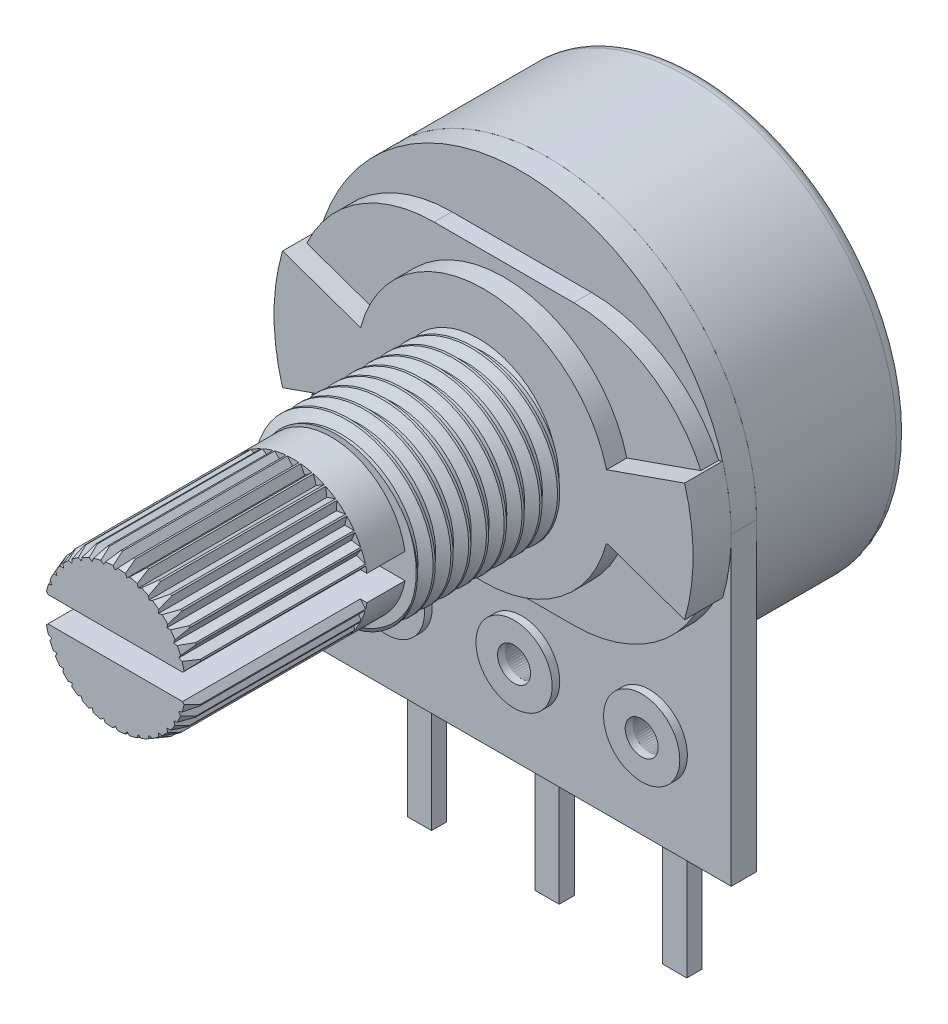
from build123d import *
from OCP.BRepFilletAPI import BRepFilletAPI_MakeChamfer

# Parameters (mm, degrees)
SKETCH1_R                   = 8.25
BOSS_EXTRUDE1_DEPTH         = 6
BOSS_EXTRUDE2_DEPTH         = 1
SKETCH3_R                   = 0.65
BOSS_EXTRUDE3_DEPTH         = 0.6
BOSS_EXTRUDE3_2_DEPTH       = 0.6
BOSS_EXTRUDE3_3_DEPTH       = 0.6
BOSS_EXTRUDE4_DEPTH         = 1.5
BOSS_EXTRUDE8_DEPTH         = 0.7
SKETCH5_R                   = 3.35
BOSS_EXTRUDE5_DEPTH         = 6
BOSS_EXTRUDE6_DEPTH         = 8.5
THREAD1_PITCH               = 0.7
CHAMFER1_SIZE               = 0.5
CHAMFER1_SIZE2              = 0.181985117
CUT_EXTRUDE2_DEPTH          = 7
SKETCH16_W                  = 3.655172414
SKETCH16_H                  = 2
CUT_EXTRUDE5_DEPTH          = 2.75
FILLET1_R                   = 0.5
SHELL2_START                = 0.5
SHELL2_DEPTH                = 5.5
SHELL2_START_2              = 3.25
SHELL2_2_DEPTH              = 2.75
CUT_EXTRUDE3_DEPTH          = 2
SKETCH13_R                  = 0.65
CUT_EXTRUDE4_DEPTH          = 2
BOSS_EXTRUDE7_START         = -1
BOSS_EXTRUDE7_OUTLINE_R     = 1.5
BOSS_EXTRUDE7_OUTLINE_R_2   = 0.65
BOSS_EXTRUDE7_DEPTH         = 1.3
BOSS_EXTRUDE7_2_OUTLINE_R   = 1.5
BOSS_EXTRUDE7_2_OUTLINE_R_2 = 0.65
BOSS_EXTRUDE7_2_DEPTH       = 1.3
BOSS_EXTRUDE7_3_OUTLINE_R   = 1.5
BOSS_EXTRUDE7_3_OUTLINE_R_2 = 0.65
BOSS_EXTRUDE7_3_DEPTH       = 1.3


# Read off the part's stored shape, not the designer's step: Shell2, Boss-Extrude7
with BuildPart() as part:
    # Sketch1 → Boss-Extrude1 (new body)
    with BuildSketch(Plane.XY):
        Circle(SKETCH1_R)
    extrude(amount=BOSS_EXTRUDE1_DEPTH)

    # Sketch16 → Cut-Extrude5 (cut)
    with BuildSketch(Plane(origin=(0, 0, 0), x_dir=(-1, 0, 0), z_dir=(0, 0, -1))):
        with Locations((8.327586207, 0)):
            Rectangle(SKETCH16_W, SKETCH16_H)
    extrude(amount=-CUT_EXTRUDE5_DEPTH, mode=Mode.SUBTRACT)

    # Fillet1
    fillet1_edges = [part.edges().sort_by_distance(p)[0] for p in [
        (0.500924228, 8.234778377, 0),
        (-8.25, 0, 2.75),
        (-6.5, 0, 0),
    ]]
    fillet(fillet1_edges, radius=FILLET1_R)

    # Shell2 outline → Shell2 (cut)
    with BuildSketch(Plane.XY.offset(SHELL2_START)):
        with BuildLine():
            ThreePointArc((-7.685213074, -1), (7.75, 0), (-7.685213074, 1))
            Line((-7.685213074, 1), (-6, 1))
            Line((-6, 1), (-6, -1))
            Line((-6, -1), (-7.685213074, -1))
        make_face()
    extrude(amount=SHELL2_DEPTH, mode=Mode.SUBTRACT)

    # Shell2 2 outline → Shell2 2 (cut)
    with BuildSketch(Plane.XY.offset(SHELL2_START_2)):
        with BuildLine():
            Line((-6, 1), (-7.685213074, 1))
            ThreePointArc((-7.685213074, 1), (-7.75, 0), (-7.685213074, -1))
            Line((-7.685213074, -1), (-6, -1))
            Line((-6, -1), (-6, 1))
        make_face()
    extrude(amount=SHELL2_2_DEPTH, mode=Mode.SUBTRACT)

    # Sketch12 → Cut-Extrude3 (cut)
    with BuildSketch(Plane(origin=(0, 0, 6), x_dir=(-1, 0, 0), z_dir=(0, 0, -1))):
        with BuildLine():
            Line((-6.020797289, -6), (6.020797289, -6))
            ThreePointArc((6.020797289, -6), (0, -8.5), (-6.020797289, -6))
        make_face()
    extrude(amount=CUT_EXTRUDE3_DEPTH, mode=Mode.SUBTRACT)


with BuildPart() as body_2:
    # Sketch2 → Boss-Extrude2 (new body)
    with BuildSketch(Plane.XY.offset(6)):
        with BuildLine():
            Line((-8.25, 0), (-8.25, -12))
            Line((-8.25, -12), (8.25, -12))
            Line((8.25, -12), (8.25, 0))
            ThreePointArc((8.25, 0), (0, 8.25), (-8.25, 0))
        make_face()
    extrude(amount=BOSS_EXTRUDE2_DEPTH)

    # Sketch13 → Cut-Extrude4 (cut)
    with BuildSketch(Plane(origin=(0, 0, 6), x_dir=(-1, 0, 0), z_dir=(0, 0, -1))):
        with Locations((-5.025, -8.4)):
            Circle(SKETCH13_R)
        with Locations((0, -8.4)):
            Circle(SKETCH13_R)
        with Locations((5.025, -8.4)):
            Circle(SKETCH13_R)
    extrude(amount=-CUT_EXTRUDE4_DEPTH, mode=Mode.SUBTRACT)


with BuildPart() as body_3:
    # Sketch3 → Boss-Extrude3 (new body)
    with BuildSketch(Plane(origin=(0, 0, 6), x_dir=(-1, 0, 0), z_dir=(0, 0, -1))):
        with BuildLine():
            Line((0.475, -12.7), (0.475, -17))
            Line((0.475, -17), (-0.475, -17))
            Line((-0.475, -17), (-0.475, -12.7))
            Line((-0.475, -12.7), (-1.8, -12.7))
            Line((-1.8, -12.7), (-1.8, -8.4))
            ThreePointArc((-1.8, -8.4), (-1.360660172, -7.339339828), (-0.3, -6.9))
            Line((-0.3, -6.9), (0.3, -6.9))
            ThreePointArc((0.3, -6.9), (1.360660172, -7.339339828), (1.8, -8.4))
            Line((1.8, -8.4), (1.8, -12.7))
            Line((1.8, -12.7), (0.475, -12.7))
        make_face()
        with Locations((0, -8.4)):
            Circle(SKETCH3_R, mode=Mode.SUBTRACT)
    extrude(amount=BOSS_EXTRUDE3_DEPTH)

    # Boss-Extrude7 2 outline → Boss-Extrude7 2 (add)
    with BuildSketch(Plane.XY.offset(7).offset(BOSS_EXTRUDE7_START)):
        with Locations((0, -8.4)):
            Circle(BOSS_EXTRUDE7_2_OUTLINE_R)
        with Locations((0, -8.4)):
            Circle(BOSS_EXTRUDE7_2_OUTLINE_R_2, mode=Mode.SUBTRACT)
    extrude(amount=BOSS_EXTRUDE7_2_DEPTH)


with BuildPart() as body_4:
    # Sketch3 → Boss-Extrude3 2 (new body)
    with BuildSketch(Plane(origin=(0, 0, 6), x_dir=(-1, 0, 0), z_dir=(0, 0, -1))):
        with BuildLine():
            Line((5.5, -12.7), (5.5, -17))
            Line((5.5, -17), (4.55, -17))
            Line((4.55, -17), (4.55, -12.7))
            Line((4.55, -12.7), (3.225, -12.7))
            Line((3.225, -12.7), (3.225, -8.4))
            ThreePointArc((3.225, -8.4), (3.664339828, -7.339339828), (4.725, -6.9))
            Line((4.725, -6.9), (5.325, -6.9))
            ThreePointArc((5.325, -6.9), (6.385660172, -7.339339828), (6.825, -8.4))
            Line((6.825, -8.4), (6.825, -12.7))
            Line((6.825, -12.7), (5.5, -12.7))
        make_face()
        with Locations((5.025, -8.4)):
            Circle(SKETCH3_R, mode=Mode.SUBTRACT)
    extrude(amount=BOSS_EXTRUDE3_2_DEPTH)

    # Boss-Extrude7 3 outline → Boss-Extrude7 3 (add)
    with BuildSketch(Plane.XY.offset(7).offset(BOSS_EXTRUDE7_START)):
        with Locations((-5.025, -8.4)):
            Circle(BOSS_EXTRUDE7_3_OUTLINE_R)
        with Locations((-5.025, -8.4)):
            Circle(BOSS_EXTRUDE7_3_OUTLINE_R_2, mode=Mode.SUBTRACT)
    extrude(amount=BOSS_EXTRUDE7_3_DEPTH)


with BuildPart() as body_5:
    # Sketch3 → Boss-Extrude3 3 (new body)
    with BuildSketch(Plane(origin=(0, 0, 6), x_dir=(-1, 0, 0), z_dir=(0, 0, -1))):
        with BuildLine():
            Line((-4.55, -12.7), (-4.55, -17))
            Line((-4.55, -17), (-5.5, -17))
            Line((-5.5, -17), (-5.5, -12.7))
            Line((-5.5, -12.7), (-6.825, -12.7))
            Line((-6.825, -12.7), (-6.825, -8.4))
            ThreePointArc((-6.825, -8.4), (-6.385660172, -7.339339828), (-5.325, -6.9))
            Line((-5.325, -6.9), (-4.725, -6.9))
            ThreePointArc((-4.725, -6.9), (-3.664339828, -7.339339828), (-3.225, -8.4))
            Line((-3.225, -8.4), (-3.225, -12.7))
            Line((-3.225, -12.7), (-4.55, -12.7))
        make_face()
        with Locations((-5.025, -8.4)):
            Circle(SKETCH3_R, mode=Mode.SUBTRACT)
    extrude(amount=BOSS_EXTRUDE3_3_DEPTH)

    # Boss-Extrude7 outline → Boss-Extrude7 (add)
    with BuildSketch(Plane.XY.offset(7).offset(BOSS_EXTRUDE7_START)):
        with Locations((5.025, -8.4)):
            Circle(BOSS_EXTRUDE7_OUTLINE_R)
        with Locations((5.025, -8.4)):
            Circle(BOSS_EXTRUDE7_OUTLINE_R_2, mode=Mode.SUBTRACT)
    extrude(amount=BOSS_EXTRUDE7_DEPTH)


with BuildPart() as body_6:
    # Sketch4 → Boss-Extrude4 (new body)
    with BuildSketch(Plane.XY.offset(7)):
        with BuildLine():
            Line((-7.914139246, 2.33), (-4.841229183, 1.25))
            ThreePointArc((-4.841229183, 1.25), (0, 5), (4.841229183, 1.25))
            Line((4.841229183, 1.25), (7.914139246, 2.33))
            ThreePointArc((7.914139246, 2.33), (8.25, 0), (7.914139246, -2.33))
            Line((7.914139246, -2.33), (4.841229183, -1.25))
            ThreePointArc((4.841229183, -1.25), (0, -5), (-4.841229183, -1.25))
            Line((-4.841229183, -1.25), (-7.914139246, -2.33))
            ThreePointArc((-7.914139246, -2.33), (-8.25, 0), (-7.914139246, 2.33))
        make_face()
    extrude(amount=BOSS_EXTRUDE4_DEPTH)

    # Sketch15 → Boss-Extrude8 (add)
    with BuildSketch(Plane.XY.offset(7)):
        with BuildLine():
            Line((2.75, -5.5), (-2.75, -5.5))
            ThreePointArc((-2.75, -5.5), (-8.25, 0), (-2.75, 5.5))
            Line((-2.75, 5.5), (2.75, 5.5))
            ThreePointArc((2.75, 5.5), (8.25, 0), (2.75, -5.5))
        make_face()
    extrude(amount=BOSS_EXTRUDE8_DEPTH)


with BuildPart() as body_7:
    # Sketch5 → Boss-Extrude5 (new body)
    with BuildSketch(Plane.XY.offset(8.5)):
        Circle(SKETCH5_R)
    extrude(amount=BOSS_EXTRUDE5_DEPTH)

    # Sketch6 → Boss-Extrude6 (add)
    with BuildSketch(Plane.XY.offset(14.5)):
        with BuildLine():
            Line((-2.907318352, 0.5), (2.907318352, 0.5))
            ThreePointArc((2.907318352, 0.5), (0, 2.95), (-2.907318352, 0.5))
        make_face()
        with BuildLine():
            Line((-2.907318352, -0.5), (2.907318352, -0.5))
            ThreePointArc((2.907318352, -0.5), (0, -2.95), (-2.907318352, -0.5))
        make_face()
    extrude(amount=BOSS_EXTRUDE6_DEPTH)

    # Thread1: the profile of Thread Profile1 profile screwed along a right-hand helix of 10 turns, 6 arcs to a turn; built about Z, then put on its axis
    thread1_z = Axis((0, 0, 0), (0, 0, 1))
    thread1_corners = [(3.3503, 0, -0.000173205), (3.3503, 0, 0.612673203), (2.971113888, 0, 0.393749999), (2.971113888, 0, 0.218749999)]
    with BuildLine(mode=Mode.PRIVATE) as thread1_profile:
        Line(thread1_corners[0], thread1_corners[1])
        Line(thread1_corners[1], thread1_corners[2])
        Line(thread1_corners[2], thread1_corners[3])
        Line(thread1_corners[3], thread1_corners[0])
    thread1_cap = Face(thread1_profile.wire())
    thread1_turn_angles = [0, 30, 60, 90, 120, 150, 180, 210, 240, 270, 300, 330, 360]
    thread1_turn_weights = [1, 0.8660254037844387, 1, 0.8660254037844387, 1, 0.8660254037844387, 1, 0.8660254037844387, 1, 0.8660254037844387, 1, 0.8660254037844387, 1]
    thread1_turn_rails = [Edge.make_bspline([Vector(p[0], p[1], 0).rotate(thread1_z, thread1_turn_angles[k]) / thread1_turn_weights[k] + Vector(0, 0, p[2] + THREAD1_PITCH * thread1_turn_angles[k] / 360) for k in range(13)], [0, 0, 0, 1, 1, 2, 2, 3, 3, 4, 4, 5, 5, 6, 6, 6], 2, thread1_turn_weights) for p in thread1_corners]
    thread1_turn_sides = [Face.make_surface_from_curves(thread1_turn_rails[p[0]], thread1_turn_rails[p[1]]) for p in [(0, 1), (1, 2), (2, 3), (3, 0)]]
    thread1 = Plane(origin=(0, 0, 15.5), x_dir=(-1, 0, 0), z_dir=(0, 0, -1)) * Solid(Shell([*[p.moved(Location((0, 0, THREAD1_PITCH * i))) for i in range(10) for p in thread1_turn_sides], thread1_cap, thread1_cap.rotate(thread1_z, 3600).moved(Location((0, 0, THREAD1_PITCH * 3600 / 360)))]))
    add(thread1, mode=Mode.SUBTRACT)

    # Chamfer1: one chamfer whose edges measure the first distance from different faces: ONE call of the kernel's chamfer builder (chamfer() names one face for all edges)
    chamfer1_edges_1 = [body_7.edges().sort_by_distance(p)[0] for p in [
        (0, -2.95, 23),
    ]]
    chamfer1_side_1 = [body_7.faces().sort_by_distance(p)[0] for p in [
        (0, -2.95, 18.75),
    ]]
    chamfer1_edges_2 = [body_7.edges().sort_by_distance(p)[0] for p in [
        (0, 2.95, 23),
    ]]
    chamfer1_side_2 = [body_7.faces().sort_by_distance(p)[0] for p in [
        (0, 2.95, 18.75),
    ]]
    chamfer1 = BRepFilletAPI_MakeChamfer(body_7.part.solid().wrapped)
    for e in chamfer1_edges_1:
        chamfer1.Add(CHAMFER1_SIZE, CHAMFER1_SIZE2, e.wrapped, chamfer1_side_1[0].wrapped)  # the first distance lies on this face
    for e in chamfer1_edges_2:
        chamfer1.Add(CHAMFER1_SIZE, CHAMFER1_SIZE2, e.wrapped, chamfer1_side_2[0].wrapped)  # the first distance lies on this face
    add(Compound.cast(chamfer1.Shape()), mode=Mode.REPLACE)

    # Sketch10 → Cut-Extrude2 (cut)
    with BuildSketch(Plane.XY.offset(23)):
        Polygon((-0.238184663, 2.968071606), (0, 2.656918662), (0.254999112, 2.966780407), align=None)
        Polygon((0.766301114, 2.877428215), (0.280834123, 2.964340261), (0.461369084, 2.616554098), align=None)
        Polygon((1.254319444, 2.700646823), (0.791319906, 2.870538938), (0.908719702, 2.496686861), align=None)
        Polygon((1.704225913, 2.441807643), (1.277761834, 2.689517742), (1.328459331, 2.300959057), align=None)
        Polygon((2.102350339, 2.108775375), (1.725379615, 2.426776911), (1.707834396, 2.035317777), align=None)
        Polygon((2.436595914, 1.711669033), (2.12057261, 2.09029969), (2.035317777, 1.707834396), align=None)
        Polygon((2.696806756, 1.262554494), (2.451333079, 1.690309772), (2.300959057, 1.328459331), align=None)
        Polygon((2.875076489, 0.775077876), (2.707611033, 1.238960646), (2.496686861, 0.908719702), align=None)
        Polygon((2.965988477, 0.264050908), (2.881619596, 0.749966328), (2.616554098, 0.461369084), align=None)
        Polygon((2.966780407, -0.254999112), (2.968071606, 0.238184663), (2.656918662, 0), align=None)
        Polygon((2.877428215, -0.766301114), (2.964340261, -0.280834123), (2.616554098, -0.461369084), align=None)
        Polygon((2.700646823, -1.254319444), (2.870538938, -0.791319906), (2.496686861, -0.908719702), align=None)
        Polygon((2.441807643, -1.704225913), (2.689517742, -1.277761834), (2.300959057, -1.328459331), align=None)
        Polygon((2.108775375, -2.102350339), (2.426776911, -1.725379615), (2.035317777, -1.707834396), align=None)
        Polygon((1.711669033, -2.436595914), (2.09029969, -2.12057261), (1.707834396, -2.035317777), align=None)
        Polygon((1.262554494, -2.696806756), (1.690309772, -2.451333079), (1.328459331, -2.300959057), align=None)
        Polygon((0.775077876, -2.875076489), (1.238960646, -2.707611033), (0.908719702, -2.496686861), align=None)
        Polygon((0.264050908, -2.965988477), (0.749966328, -2.881619596), (0.461369084, -2.616554098), align=None)
        Polygon((-0.254999112, -2.966780407), (0.238184663, -2.968071606), (0, -2.656918662), align=None)
        Polygon((-0.766301114, -2.877428215), (-0.280834123, -2.964340261), (-0.461369084, -2.616554098), align=None)
        Polygon((-1.254319444, -2.700646823), (-0.791319906, -2.870538938), (-0.908719702, -2.496686861), align=None)
        Polygon((-1.704225913, -2.441807643), (-1.277761834, -2.689517742), (-1.328459331, -2.300959057), align=None)
        Polygon((-2.102350339, -2.108775375), (-1.725379615, -2.426776911), (-1.707834396, -2.035317777), align=None)
        Polygon((-2.436595914, -1.711669033), (-2.12057261, -2.09029969), (-2.035317777, -1.707834396), align=None)
        Polygon((-2.696806756, -1.262554494), (-2.451333079, -1.690309772), (-2.300959057, -1.328459331), align=None)
        Polygon((-2.875076489, -0.775077876), (-2.707611033, -1.238960646), (-2.496686861, -0.908719702), align=None)
        Polygon((-2.965988477, -0.264050908), (-2.881619596, -0.749966328), (-2.616554098, -0.461369084), align=None)
        Polygon((-2.966780407, 0.254999112), (-2.968071606, -0.238184663), (-2.656918662, 0), align=None)
        Polygon((-2.877428215, 0.766301114), (-2.964340261, 0.280834123), (-2.616554098, 0.461369084), align=None)
        Polygon((-2.700646823, 1.254319444), (-2.870538938, 0.791319906), (-2.496686861, 0.908719702), align=None)
        Polygon((-2.441807643, 1.704225913), (-2.689517742, 1.277761834), (-2.300959057, 1.328459331), align=None)
        Polygon((-2.108775375, 2.102350339), (-2.426776911, 1.725379615), (-2.035317777, 1.707834396), align=None)
        Polygon((-1.711669033, 2.436595914), (-2.09029969, 2.12057261), (-1.707834396, 2.035317777), align=None)
        Polygon((-1.262554494, 2.696806756), (-1.690309772, 2.451333079), (-1.328459331, 2.300959057), align=None)
        Polygon((-0.775077876, 2.875076489), (-1.238960646, 2.707611033), (-0.908719702, 2.496686861), align=None)
        Polygon((-0.264050908, 2.965988477), (-0.749966328, 2.881619596), (-0.461369084, 2.616554098), align=None)
    extrude(amount=-CUT_EXTRUDE2_DEPTH, mode=Mode.SUBTRACT)


solid = Compound([part.part, body_2.part, body_3.part, body_4.part, body_5.part, body_6.part, body_7.part])
